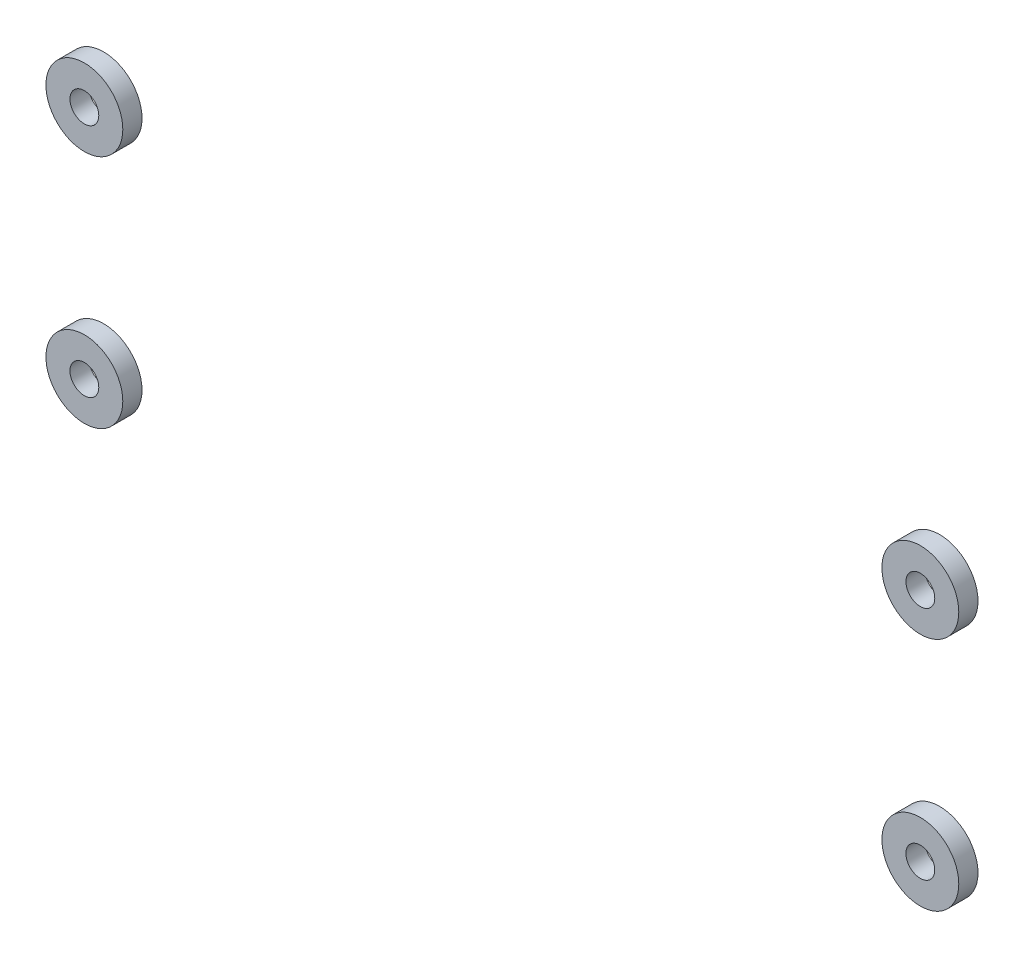
from build123d import *

# Parameters (mm, degrees)
SKETCH1_R             = 4
SKETCH1_R_2           = 1.5
BOSS_EXTRUDE1_DEPTH   = 2
BOSS_EXTRUDE1_2_DEPTH = 2
BOSS_EXTRUDE1_3_DEPTH = 2
BOSS_EXTRUDE1_4_DEPTH = 2


with BuildPart() as part:
    # Sketch1 → Boss-Extrude1 (new body)
    with BuildSketch(Plane.XY):
        with Locations((43.5, -12.25)):
            Circle(SKETCH1_R)
        with Locations((43.5, -12.25)):
            Circle(SKETCH1_R_2, mode=Mode.SUBTRACT)
    extrude(amount=BOSS_EXTRUDE1_DEPTH)


with BuildPart() as body_2:
    # Sketch1 → Boss-Extrude1 2 (new body)
    with BuildSketch(Plane.XY):
        with Locations((43.5, 12.25)):
            Circle(SKETCH1_R)
        with Locations((43.5, 12.25)):
            Circle(SKETCH1_R_2, mode=Mode.SUBTRACT)
    extrude(amount=BOSS_EXTRUDE1_2_DEPTH)


with BuildPart() as body_3:
    # Sketch1 → Boss-Extrude1 3 (new body)
    with BuildSketch(Plane.XY):
        with Locations((-43.5, -12.25)):
            Circle(SKETCH1_R)
        with Locations((-43.5, -12.25)):
            Circle(SKETCH1_R_2, mode=Mode.SUBTRACT)
    extrude(amount=BOSS_EXTRUDE1_3_DEPTH)


with BuildPart() as body_4:
    # Sketch1 → Boss-Extrude1 4 (new body)
    with BuildSketch(Plane.XY):
        with Locations((-43.5, 12.25)):
            Circle(SKETCH1_R)
        with Locations((-43.5, 12.25)):
            Circle(SKETCH1_R_2, mode=Mode.SUBTRACT)
    extrude(amount=BOSS_EXTRUDE1_4_DEPTH)


solid = Compound([part.part, body_2.part, body_3.part, body_4.part])
